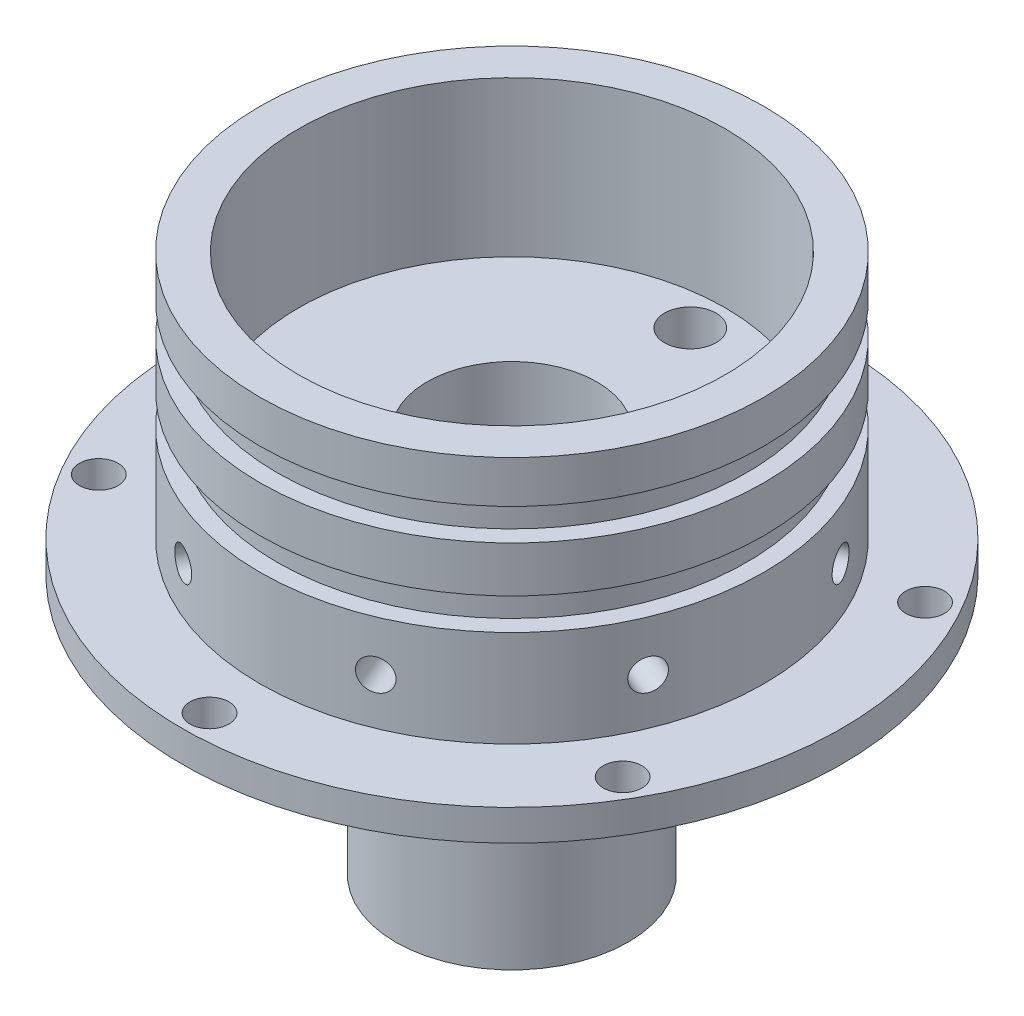
from build123d import *

# Parameters (mm, degrees)
CIRPATTERN1_COUNT           = 8
LPATTERN1_START             = -24.818843944
LPATTERN1_OUTLINE_R         = 41.275
LPATTERN1_OUTLINE_R_2       = 38.453474767
LPATTERN1_DEPTH             = 5.187687888
LPATTERN1_START_2           = -12.118843944
LPATTERN1_2_OUTLINE_R       = 41.275
LPATTERN1_2_OUTLINE_R_2     = 38.453474767
LPATTERN1_2_DEPTH           = 5.187687888
SKETCH15_R                  = 53.975
SKETCH15_R_2                = 19.05
BOSS_EXTRUDE1_DEPTH         = 5.08
Q_0_332_DIAMETER_HOLE1_D    = 8.4328
F_1_4_0_25_DIAMETER_HOLE1_D = 6.35
CIRPATTERN2_COUNT           = 6


# Read off the part's stored shape, not the designer's step: LPattern1
with BuildPart() as part:
    # Sketch1 → Revolve1 (revolve)
    with BuildSketch(Plane.XY, mode=Mode.PRIVATE) as revolve1_sk:
        Polygon((-41.275, -40.64), (-41.275, 0), (-34.925, 0), (-34.925, -25.4), (-13.91158, -25.4), (-13.91158, -74.93), (-8.90651, -74.93), (-8.90651, -88.392), (-19.05, -88.392), (-19.05, -40.64), align=None)
    revolve(revolve1_sk.sketch.rotate(Axis((0, 0, 0), (0, 1, 0)), 270), axis=Axis((0, 0, 0), (0, 1, 0)))

    # Sketch8 → 1/4-20 Tapped Hole1 (revolve, cut)
    with BuildSketch(Plane(origin=(38.133127704, -33.02, -15.795258671), x_dir=(-0.38268343236509045, 0, -0.9238795325112865), z_dir=(0, 1, 0))):
        Polygon((0, 0), (0, 14.233816902), (2.5527, 12.7), (2.5527, 0), align=None)
    f_1_4_20_tapped_hole1 = revolve(axis=Axis((43.999762736, -33.02, -18.225298466), (-0.9238795325112865, 0, 0.38268343236509045)), mode=Mode.SUBTRACT)

    # CirPattern1: 1/4-20 Tapped Hole1 ×8 about axis
    cirpattern1_axis = Axis((0, -118.183018713, 0), (0, 1, 0))
    for i in range(1, CIRPATTERN1_COUNT):
        add(f_1_4_20_tapped_hole1.rotate(cirpattern1_axis, i * 360 / CIRPATTERN1_COUNT), mode=Mode.SUBTRACT)

    # LPattern1 outline → LPattern1 (cut)
    with BuildSketch(Plane(origin=(0, 0, 0), x_dir=(1, 0, 0), z_dir=(0, 1, 0)).offset(LPATTERN1_START)):
        Circle(LPATTERN1_OUTLINE_R)
        Circle(LPATTERN1_OUTLINE_R_2, mode=Mode.SUBTRACT)
    extrude(amount=LPATTERN1_DEPTH, mode=Mode.SUBTRACT)

    # LPattern1 2 outline → LPattern1 2 (cut)
    with BuildSketch(Plane(origin=(0, 0, 0), x_dir=(1, 0, 0), z_dir=(0, 1, 0)).offset(LPATTERN1_START_2)):
        Circle(LPATTERN1_2_OUTLINE_R)
        Circle(LPATTERN1_2_OUTLINE_R_2, mode=Mode.SUBTRACT)
    extrude(amount=LPATTERN1_2_DEPTH, mode=Mode.SUBTRACT)

    # Sketch15 → Boss-Extrude1 (add)
    with BuildSketch(Plane.XZ.offset(40.64)):
        with Locations(Location((0, 0, 0), (0, 0, 270))):
            Circle(SKETCH15_R)
        with Locations(Location((0, 0, 0), (0, 0, 270))):
            Circle(SKETCH15_R_2, mode=Mode.SUBTRACT)
    extrude(amount=BOSS_EXTRUDE1_DEPTH)

    # Q (0.332) Diameter Hole1 (through all)
    with Locations(Plane(origin=(0, -45.72, 0), x_dir=(-1, 0, 0), z_dir=(0, -1, 0))):
        with Locations((0, 29.21)):
            Hole(Q_0_332_DIAMETER_HOLE1_D / 2)

    # 1/4 (0.25) Diameter Hole1 (through all)
    with Locations(Plane(origin=(0, -45.72, 0), x_dir=(-1, 0, 0), z_dir=(0, -1, 0))):
        with Locations((0, 49.53)):
            f_1_4_0_25_diameter_hole1 = Hole(F_1_4_0_25_DIAMETER_HOLE1_D / 2)

    # CirPattern2: 1/4 (0.25) Diameter Hole1 ×6 about axis
    cirpattern2_axis = Axis((0, 0, 0), (0, 1, 0))
    for i in range(1, CIRPATTERN2_COUNT):
        add(f_1_4_0_25_diameter_hole1.rotate(cirpattern2_axis, i * 360 / CIRPATTERN2_COUNT), mode=Mode.SUBTRACT)


solid = part.part
